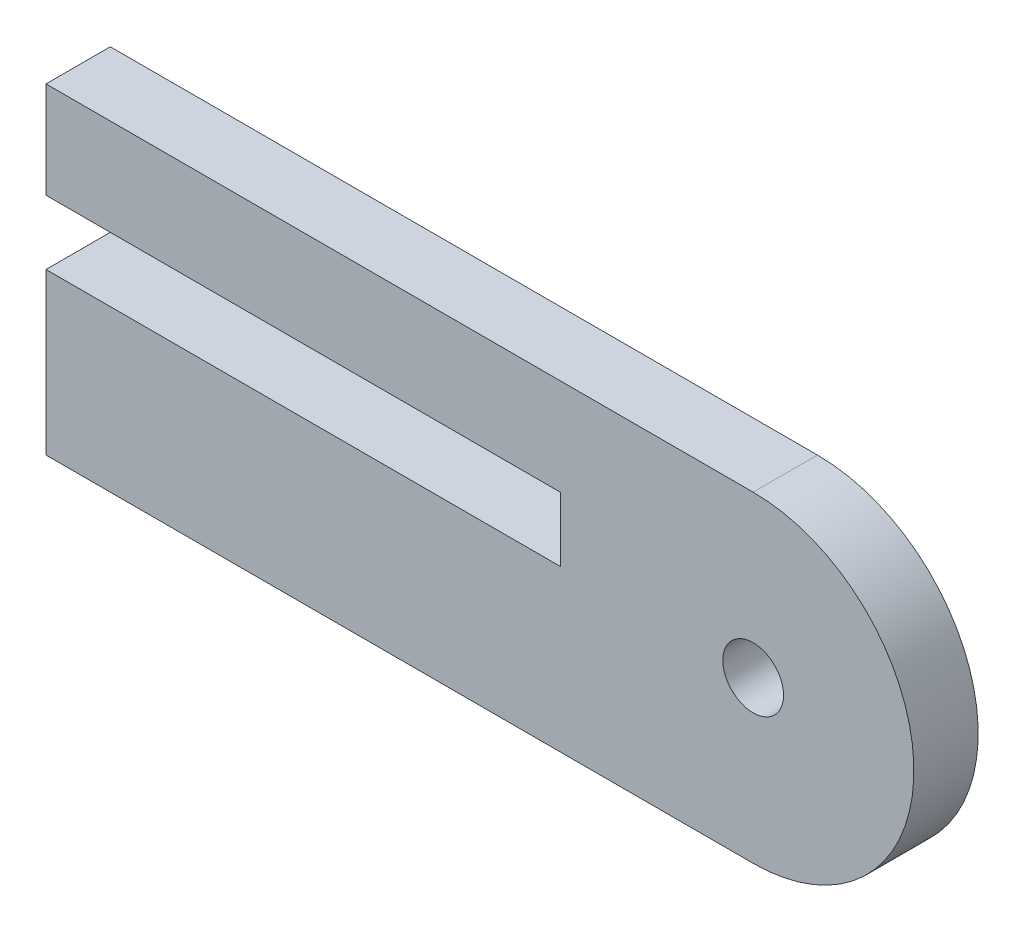
from build123d import *

# Parameters (mm, degrees)
SKETCH1_R           = 1.5
BOSS_EXTRUDE1_DEPTH = 3.175


with BuildPart() as part:
    # Sketch1 → Boss-Extrude1 (new body)
    with BuildSketch(Plane.XY):
        with BuildLine():
            Line((0, 4.7625), (0, 0))
            Line((0, 0), (34.925, 0))
            ThreePointArc((34.925, 0), (42.8625, 7.9375), (34.925, 15.875))
            Line((34.925, 15.875), (0, 15.875))
            Line((0, 15.875), (0, 11.1125))
            Line((0, 11.1125), (25.4, 11.1125))
            Line((25.4, 11.1125), (25.4, 7.9375))
            Line((25.4, 7.9375), (0, 7.9375))
            Line((0, 7.9375), (0, 4.7625))
        make_face()
        with Locations((34.925, 7.9375)):
            Circle(SKETCH1_R, mode=Mode.SUBTRACT)
    extrude(amount=BOSS_EXTRUDE1_DEPTH)


solid = part.part
